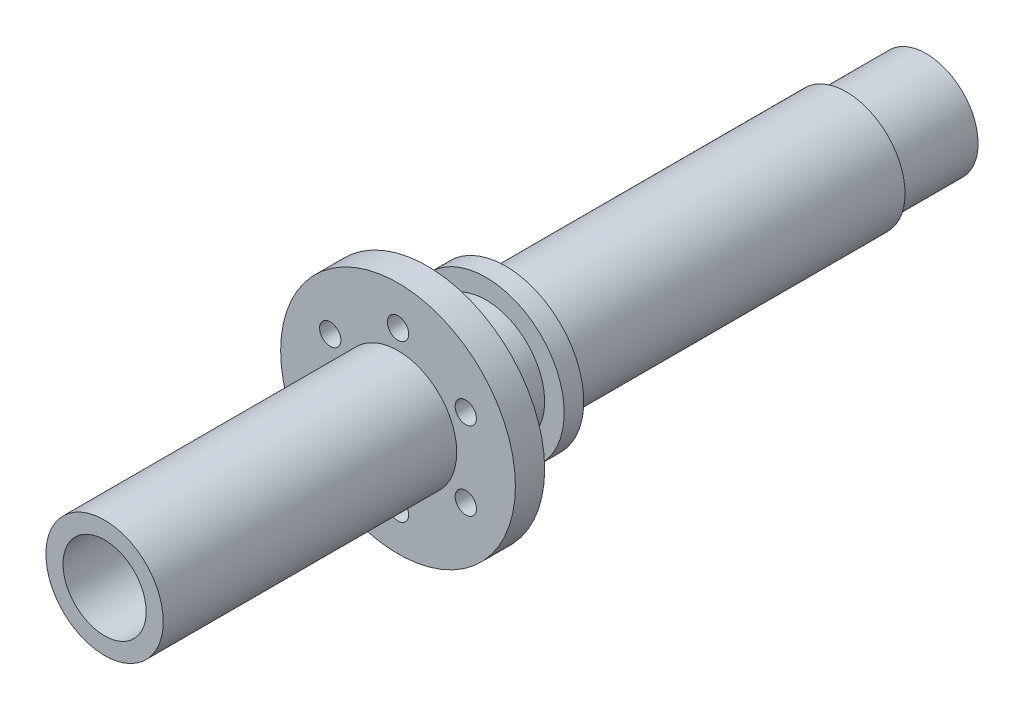
from build123d import *

# Parameters (mm, degrees)
SKETCH1_R                      = 9.525
BOSS_EXTRUDE1_DEPTH            = 80.9625
SKETCH2_R                      = 19.05
BOSS_EXTRUDE2_DEPTH            = 4.7498
SKETCH5_OUTSIDE_W              = 60.348
SKETCH5_OUTSIDE_H              = 60.348
SKETCH5_OUTSIDE_R              = 8.4328
CUT_EXTRUDE1_DEPTH             = 12.954
SKETCH7_R                      = 12.7
BOSS_EXTRUDE3_DEPTH            = 3.175
F_8_32_TAPPED_HOLE1_AT_2_COUNT = 2
F_8_32_TAPPED_HOLE1_AT_2_PITCH = 12.7
F_8_32_TAPPED_HOLE1_AT_3_COUNT = 2
F_8_32_TAPPED_HOLE1_AT_3_PITCH = 21.997045256
F_8_32_TAPPED_HOLE1_AT_4_COUNT = 2
F_8_32_TAPPED_HOLE1_AT_4_PITCH = 25.4
F_8_32_TAPPED_HOLE1_AT_5_COUNT = 2
F_8_32_TAPPED_HOLE1_AT_5_PITCH = 21.997045256
F_8_32_TAPPED_HOLE1_AT_6_COUNT = 2
F_8_32_TAPPED_HOLE1_AT_6_PITCH = 12.7
SKETCH6_R                      = 6.35
CUT_EXTRUDE2_DEPTH             = 90.846554588
SKETCH10_R                     = 9.525
SKETCH10_R_2                   = 6.35
BOSS_EXTRUDE4_DEPTH            = 47.625
F_5_8_11_TAPPED_HOLE1_D        = 13.49248
F_5_8_11_TAPPED_HOLE1_DEPTH    = 25.4
F_5_8_11_TAPPED_HOLE1_TIP      = 4.053549943
CUT_EXTRUDE3_DEPTH             = 1.5875
FILLET1_R                      = 0.79375
CHAMFER1_SIZE                  = 0.254


with BuildPart() as part:
    # Sketch1 → Boss-Extrude1 (new body)
    with BuildSketch(Plane.XY):
        Circle(SKETCH1_R)
    extrude(amount=BOSS_EXTRUDE1_DEPTH)

    # Sketch2 → Boss-Extrude2 (add)
    with BuildSketch(Plane.XY.offset(80.9625)):
        Circle(SKETCH2_R)
    extrude(amount=BOSS_EXTRUDE2_DEPTH)

    # Sketch5 outside → Cut-Extrude1 (cut)
    with BuildSketch(Plane(origin=(0, 0, 0), x_dir=(-1, 0, 0), z_dir=(0, 0, -1))):
        Rectangle(SKETCH5_OUTSIDE_W, SKETCH5_OUTSIDE_H)
        Circle(SKETCH5_OUTSIDE_R, mode=Mode.SUBTRACT)
    extrude(amount=-CUT_EXTRUDE1_DEPTH, mode=Mode.SUBTRACT)

    # Sketch7 → Boss-Extrude3 (add)
    with BuildSketch(Plane(origin=(0, 0, 71.4375), x_dir=(-1, 0, 0), z_dir=(0, 0, -1))):
        Circle(SKETCH7_R)
    extrude(amount=BOSS_EXTRUDE3_DEPTH)

    # Sketch8 → #8-32 Tapped Hole1 (revolve, cut)
    with BuildSketch(Plane(origin=(0, 12.7, 80.9625), x_dir=(0, 1, 0), z_dir=(1, 0, 0))):
        Polygon((0, 0), (0, 11.705806461), (1.7272, 10.668), (1.7272, 0), align=None)
    f_8_32_tapped_hole1 = revolve(axis=Axis((0, 12.7, 74.6125), (0, 0, 1)), mode=Mode.SUBTRACT)

    # #8-32 Tapped Hole1 at 2: #8-32 Tapped Hole1 ×2
    with Locations(*[Vector(-0.8660254037844382, -0.500000000000001, 0) * (i * F_8_32_TAPPED_HOLE1_AT_2_PITCH) for i in range(1, F_8_32_TAPPED_HOLE1_AT_2_COUNT)]):
        add(f_8_32_tapped_hole1, mode=Mode.SUBTRACT)

    # #8-32 Tapped Hole1 at 3: #8-32 Tapped Hole1 ×2
    with Locations(*[Vector(-0.5000000000000153, -0.8660254037844298, 0) * (i * F_8_32_TAPPED_HOLE1_AT_3_PITCH) for i in range(1, F_8_32_TAPPED_HOLE1_AT_3_COUNT)]):
        add(f_8_32_tapped_hole1, mode=Mode.SUBTRACT)

    # #8-32 Tapped Hole1 at 4: #8-32 Tapped Hole1 ×2
    with Locations(*[(0, -i * F_8_32_TAPPED_HOLE1_AT_4_PITCH, 0) for i in range(1, F_8_32_TAPPED_HOLE1_AT_4_COUNT)]):
        add(f_8_32_tapped_hole1, mode=Mode.SUBTRACT)

    # #8-32 Tapped Hole1 at 5: #8-32 Tapped Hole1 ×2
    with Locations(*[Vector(0.4999999999999846, -0.8660254037844476, 0) * (i * F_8_32_TAPPED_HOLE1_AT_5_PITCH) for i in range(1, F_8_32_TAPPED_HOLE1_AT_5_COUNT)]):
        add(f_8_32_tapped_hole1, mode=Mode.SUBTRACT)

    # #8-32 Tapped Hole1 at 6: #8-32 Tapped Hole1 ×2
    with Locations(*[Vector(0.86602540378443, -0.5000000000000151, 0) * (i * F_8_32_TAPPED_HOLE1_AT_6_PITCH) for i in range(1, F_8_32_TAPPED_HOLE1_AT_6_COUNT)]):
        add(f_8_32_tapped_hole1, mode=Mode.SUBTRACT)

    # Sketch6 → Cut-Extrude2 (cut, through all)
    with BuildSketch(Plane(origin=(0, 0, 0), x_dir=(-1, 0, 0), z_dir=(0, 0, -1))):
        Circle(SKETCH6_R)
    extrude(amount=-CUT_EXTRUDE2_DEPTH, mode=Mode.SUBTRACT)

    # Sketch10 → Boss-Extrude4 (add)
    with BuildSketch(Plane.XY.offset(85.7123)):
        with Locations(Location((0, 0, 0), (0, 0, 180))):
            Circle(SKETCH10_R)
        with Locations(Location((0, 0, 0), (0, 0, 180))):
            Circle(SKETCH10_R_2, mode=Mode.SUBTRACT)
    extrude(amount=BOSS_EXTRUDE4_DEPTH)

    # 5/8-11 Tapped Hole1
    with Locations(Plane.XY.offset(133.3373)):
        with Locations((0, 0)):
            Hole(F_5_8_11_TAPPED_HOLE1_D / 2, depth=F_5_8_11_TAPPED_HOLE1_DEPTH)
            with Locations((0, 0, -(F_5_8_11_TAPPED_HOLE1_DEPTH + F_5_8_11_TAPPED_HOLE1_TIP / 2))):  # 118° drill point
                Cone(0, F_5_8_11_TAPPED_HOLE1_D / 2, F_5_8_11_TAPPED_HOLE1_TIP, mode=Mode.SUBTRACT)

    # Sketch13 → Cut-Extrude3 (cut)
    with BuildSketch(Plane(origin=(0, 0, 0), x_dir=(-1, 0, 0), z_dir=(0, 0, -1))):
        with BuildLine():
            Line((-0.79375, -6.604), (-0.79375, 6.604))
            ThreePointArc((-0.79375, 6.604), (0, 7.39775), (0.79375, 6.604))
            Line((0.79375, 6.604), (0.79375, -6.604))
            ThreePointArc((0.79375, -6.604), (0, -7.39775), (-0.79375, -6.604))
        make_face()
    extrude(amount=-CUT_EXTRUDE3_DEPTH, mode=Mode.SUBTRACT)

    # Fillet1
    # the kernel refuses this fillet: 0.79375 mm, written as the material it takes off along each edge
    with BuildSketch(Plane(origin=(0.79375, -6.300195309, 1.5875), x_dir=(0.9853201649720871, 0.17071664388506244, 0), z_dir=(0, 0, -1)), Plane(origin=(-0.79375, 6.300195309, 1.5875), x_dir=(-0.9853201649720869, -0.17071664388506383, 0), z_dir=(0, 0, -1))) as fillet1_piece_1:
        with BuildLine():
            CenterArc((0.623581926, 0.792901977), FILLET1_R, 203.344606785, 64.006660147)
            Line((-0.105190236, 0.478370264), (-0.178067452, 0.446917093))
            ThreePointArc((-0.178067452, 0.446917093), (-0.130074305, 0.285794254), (-0.078209788, -0.013550634))
            Line((-0.078209788, -0.013550634), (0.003668129, -0.079290198))
            ThreePointArc((0.003668129, -0.079290198), (0.293450318, -0.072590818), (0.583232507, -0.079290198))
            Line((0.583232507, -0.079290198), (0.586900636, 0))
        make_face()
    extrude(amount=3.054751591, mode=Mode.SUBTRACT)
    with BuildSketch(Plane(origin=(0.79375, 6.300195309, 1.5875), x_dir=(0.985320164972087, -0.17071664388506264, 0), z_dir=(0, 0, -1)), Plane(origin=(-0.79375, -6.300195309, 1.5875), x_dir=(-0.9853201649720869, 0.17071664388506363, 0), z_dir=(0, 0, -1))) as fillet1_piece_2:
        with BuildLine():
            CenterArc((0.623581926, -0.792901977), FILLET1_R, 92.648733068, 64.006660147)
            Line((-0.105190236, -0.478370264), (-0.178067452, -0.446917093))
            ThreePointArc((-0.178067452, -0.446917093), (-0.130074305, -0.285794254), (-0.078209788, 0.013550634))
            Line((-0.078209788, 0.013550634), (0.003668129, 0.079290198))
            ThreePointArc((0.003668129, 0.079290198), (0.293450318, 0.072590818), (0.583232507, 0.079290198))
            Line((0.583232507, 0.079290198), (0.586900636, 0))
        make_face()
    extrude(amount=3.054751591, mode=Mode.SUBTRACT)

    # Chamfer1
    chamfer1_edges = [part.edges().sort_by_distance(p)[0] for p in [
        (6.35, 0, 0),
        (-4.951511004, 3.975555153, 0),
        (0, -7.39775, 0),
        (0, 7.39775, 0),
        (0.987374997, 6.408680157, 0),
        (-0.987374997, 6.408680157, 0),
        (-0.987374997, -6.408680157, 0),
        (0.987374997, -6.408680157, 0),
    ]]
    chamfer(chamfer1_edges, length=CHAMFER1_SIZE)


solid = part.part
